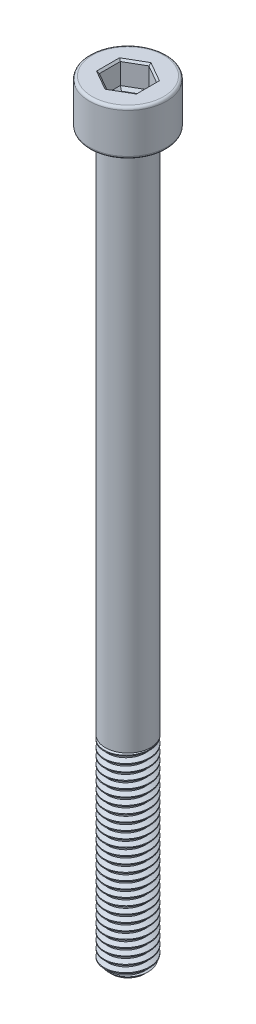
from build123d import *

# Parameters (mm, degrees)
SKETCH1_R           = 2.5
BOSS_EXTRUDE1_DEPTH = 22
THREAD1_PITCH       = 0.8
SKETCH2_R           = 2.5
BOSS_EXTRUDE2_DEPTH = 58
SKETCH3_R           = 4.25
BOSS_EXTRUDE3_DEPTH = 5
FILLET1_R           = 0.3
CUT_EXTRUDE1_DEPTH  = 2.5
CHAMFER1_SIZE       = 0.2
CUT_EXTRUDE2_DEPTH  = 0.3
CUT_EXTRUDE2_DRAFT  = -45


with BuildPart() as part:
    # Sketch1 → Boss-Extrude1 (new body)
    with BuildSketch(Plane(origin=(0, 0, 0), x_dir=(1, 0, 0), z_dir=(0, 1, 0))):
        with Locations(Location((0, 0, 0), (0, 0, 270))):
            Circle(SKETCH1_R)
    extrude(amount=BOSS_EXTRUDE1_DEPTH)

    # Thread1: arcs per turn and ends read off the stored shape
    # Thread1: the profile of Thread Profile1 profile screwed along a right-hand helix through 30 turns, 8 arcs to a turn; built about Z, then put on its axis
    thread1_z = Axis((0, 0, 0), (0, 0, 1))
    thread1_corners = [(2.5003, 0, -0.000173205), (2.5003, 0, 0.700173203), (2.0669873, 0, 0.449999999), (2.0669873, 0, 0.249999999)]
    with BuildLine(mode=Mode.PRIVATE) as thread1_profile:
        Line(thread1_corners[0], thread1_corners[1])
        Line(thread1_corners[1], thread1_corners[2])
        Line(thread1_corners[2], thread1_corners[3])
        Line(thread1_corners[3], thread1_corners[0])
    thread1_cap = Face(thread1_profile.wire())
    thread1_turn_angles = [0, 22.5, 45, 67.5, 90, 112.5, 135, 157.5, 180, 202.5, 225, 247.5, 270, 292.5, 315, 337.5, 360]
    thread1_turn_weights = [1, 0.9238795325112867, 1, 0.9238795325112867, 1, 0.9238795325112867, 1, 0.9238795325112867, 1, 0.9238795325112867, 1, 0.9238795325112867, 1, 0.9238795325112867, 1, 0.9238795325112867, 1]
    thread1_turn_rails = [Edge.make_bspline([Vector(p[0], p[1], 0).rotate(thread1_z, thread1_turn_angles[k]) / thread1_turn_weights[k] + Vector(0, 0, p[2] + THREAD1_PITCH * thread1_turn_angles[k] / 360) for k in range(17)], [0, 0, 0, 1, 1, 2, 2, 3, 3, 4, 4, 5, 5, 6, 6, 7, 7, 8, 8, 8], 2, thread1_turn_weights) for p in thread1_corners]
    thread1_turn_sides = [Face.make_surface_from_curves(thread1_turn_rails[p[0]], thread1_turn_rails[p[1]]) for p in [(0, 1), (1, 2), (2, 3), (3, 0)]]
    thread1 = Plane(origin=(0, 23, 0), x_dir=(-1, 0, 0), z_dir=(0, -1, 0)) * Solid(Shell([*[p.moved(Location((0, 0, THREAD1_PITCH * i))) for i in range(30) for p in thread1_turn_sides], thread1_cap, thread1_cap.rotate(thread1_z, 10800).moved(Location((0, 0, THREAD1_PITCH * 10800 / 360)))]))
    add(thread1, mode=Mode.SUBTRACT)

    # Sketch2 → Boss-Extrude2 (add)
    with BuildSketch(Plane(origin=(0, 22, 0), x_dir=(1, 0, 0), z_dir=(0, 1, 0))):
        with Locations(Location((0, 0, 0), (0, 0, 90))):
            Circle(SKETCH2_R)
    extrude(amount=BOSS_EXTRUDE2_DEPTH)

    # Sketch3 → Boss-Extrude3 (add)
    with BuildSketch(Plane(origin=(0, 80, 0), x_dir=(1, 0, 0), z_dir=(0, 1, 0))):
        with Locations(Location((0, 0, 0), (0, 0, 270))):
            Circle(SKETCH3_R)
    extrude(amount=BOSS_EXTRUDE3_DEPTH)

    # Fillet1
    fillet1_edges = [part.edges().sort_by_distance(p)[0] for p in [
        (0, 80, -4.25),
        (0, 85, -4.25),
    ]]
    fillet(fillet1_edges, radius=FILLET1_R)

    # Sketch4 → Cut-Revolve1 (revolve, cut)
    with BuildSketch(Plane.XY, mode=Mode.PRIVATE) as cut_revolve1_sk:
        Polygon((2.51, 0), (2.51, 0.7), (1.81, 0), align=None)
    revolve(cut_revolve1_sk.sketch.rotate(Axis((0, 0, 0), (0, 1, 0)), 90), axis=Axis((0, 0, 0), (0, 1, 0)), mode=Mode.SUBTRACT)

    # Sketch5 → Cut-Extrude1 (cut)
    with BuildSketch(Plane(origin=(0, 85, 0), x_dir=(1, 0, 0), z_dir=(0, 1, 0))):
        Polygon((0, 2.309401077), (-2, 1.154700538), (-2, -1.154700538), (0, -2.309401077), (2, -1.154700538), (2, 1.154700538), align=None)
    extrude(amount=-CUT_EXTRUDE1_DEPTH, mode=Mode.SUBTRACT)

    # Chamfer1
    chamfer1_edges = [part.edges().sort_by_distance(p)[0] for p in [
        (1, 85, -1.732050808),
        (-1, 85, -1.732050808),
        (-2, 85, 0),
        (-1, 85, 1.732050808),
        (1, 85, 1.732050808),
        (2, 85, 0),
    ]]
    chamfer(chamfer1_edges, length=CHAMFER1_SIZE)


with BuildPart() as cut_extrude2_tool:
    # Sketch6 → Cut-Extrude2 (with draft: the straight prism first)
    with BuildSketch(Plane(origin=(0, 82.5, 0), x_dir=(1, 0, 0), z_dir=(0, 1, 0))):
        Polygon((0, 2.309401077), (-2, 1.154700538), (-2, -1.154700538), (0, -2.309401077), (2, -1.154700538), (2, 1.154700538), align=None)
    extrude(amount=-CUT_EXTRUDE2_DEPTH)
    # Cut-Extrude2: the draft: its side faces are tilted about the plane it starts from
    cut_extrude2_sides = [cut_extrude2_tool.faces().sort_by_distance(p)[0] for p in [
        (-1, 82.35, -1.732050808),
        (-2, 82.35, 0),
        (-1, 82.35, 1.732050808),
        (1, 82.35, 1.732050808),
        (2, 82.35, 0),
        (1, 82.35, -1.732050808),
    ]]
    draft(cut_extrude2_sides, Plane(origin=(0, 82.5, 0), x_dir=(1, 0, 0), z_dir=(0, 1, 0)), CUT_EXTRUDE2_DRAFT)


with BuildPart() as part_1:
    add(part.part)

    # Cut-Extrude2: cut by cut_extrude2_tool
    add(cut_extrude2_tool.part, mode=Mode.SUBTRACT)


solid = part_1.part
